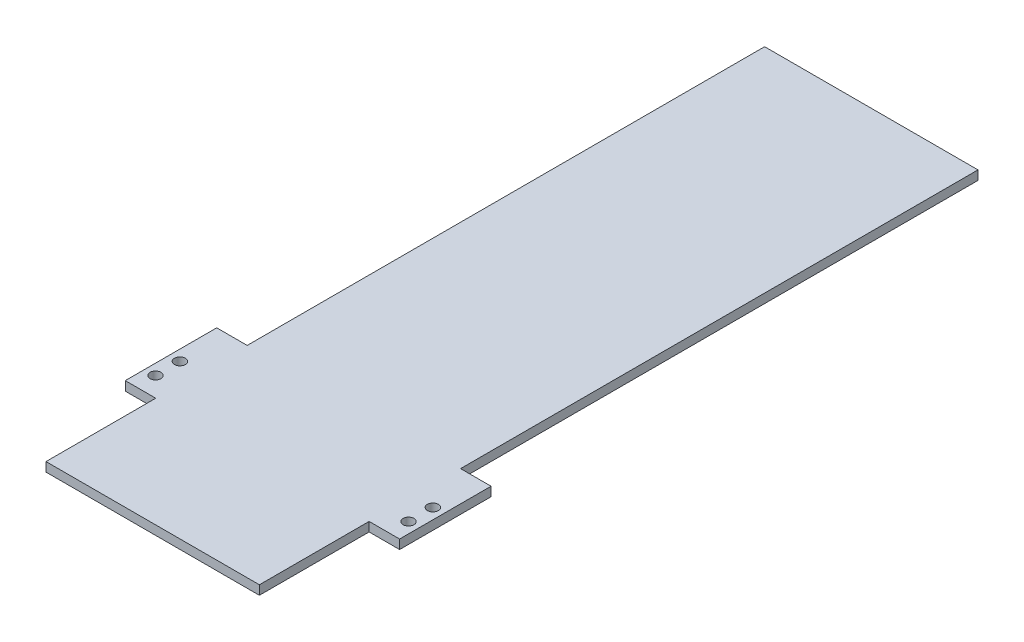
from build123d import *

# Parameters (mm, degrees)
BOSS_EXTRUDE5_DEPTH  = 3
M3_CLEARANCE_HOLE1_D = 3.6


with BuildPart() as part:
    # Sketch5 → Boss-Extrude5 (new body)
    with BuildSketch(Plane(origin=(0, 0, 0), x_dir=(1, 0, 0), z_dir=(0, 1, 0))):
        Polygon((80, 66), (70, 66), (70, 235.74), (0, 235.74), (0, 66), (-10, 66), (-10, 36), (0, 36), (0, 0), (70, 0), (70, 36), (80, 36), align=None)
    extrude(amount=BOSS_EXTRUDE5_DEPTH)

    # M3 Clearance Hole1 (through all)
    with Locations(Plane(origin=(0, 3, 0), x_dir=(1, 0, 0), z_dir=(0, 1, 0))):
        with Locations((76.5, 50.419958356), (76.5, 42.419958356)):
            m3_clearance_hole1 = Hole(M3_CLEARANCE_HOLE1_D / 2)

    # Mirror1: M3 Clearance Hole1 across plane
    add(m3_clearance_hole1.mirror(Plane.ZY.offset(-35)), mode=Mode.SUBTRACT)


solid = part.part
